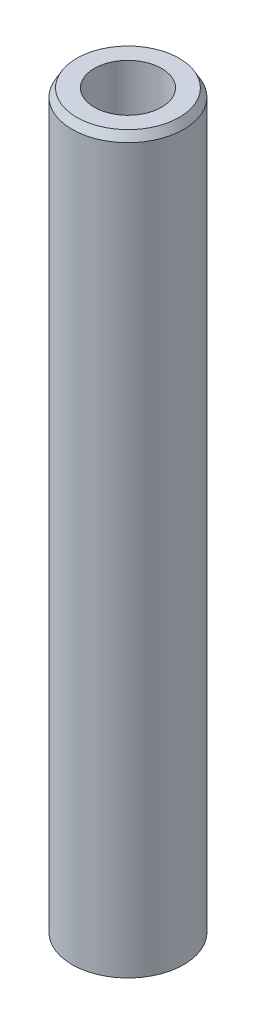
from build123d import *
from OCP.BRepFilletAPI import BRepFilletAPI_MakeChamfer

# Parameters (mm, degrees)
SKETCH1_R           = 30
BOSS_EXTRUDE1_DEPTH = 395.231846825
SKETCH2_R           = 18.0727539
CUT_EXTRUDE1_DEPTH  = 398.502468854
CHAMFER1_SIZE       = 4.315093977
CHAMFER1_SIZE2      = 2.491320669


with BuildPart() as part:
    # Sketch1 → Boss-Extrude1 (new body)
    with BuildSketch(Plane(origin=(0, 0, 0), x_dir=(1, 0, 0), z_dir=(0, 1, 0))):
        Circle(SKETCH1_R)
    extrude(amount=BOSS_EXTRUDE1_DEPTH)

    # Sketch2 → Cut-Extrude1 (cut, through all)
    with BuildSketch(Plane(origin=(0, 0, 0), x_dir=(1, 0, 0), z_dir=(0, 1, 0))):
        Circle(SKETCH2_R)
    extrude(amount=CUT_EXTRUDE1_DEPTH, mode=Mode.SUBTRACT)

    # Chamfer1: one chamfer whose edges measure the first distance from different faces: ONE call of the kernel's chamfer builder (chamfer() names one face for all edges)
    chamfer1_edges_1 = [part.edges().sort_by_distance(p)[0] for p in [
        (-30, 395.231846825, 0),
    ]]
    chamfer1_side_1 = [part.faces().sort_by_distance(p)[0] for p in [
        (-30, 197.615923413, 0),
    ]]
    chamfer1_edges_2 = [part.edges().sort_by_distance(p)[0] for p in [
        (-30, 0, 0),
    ]]
    chamfer1_side_2 = [part.faces().sort_by_distance(p)[0] for p in [
        (-29.151471863, 0, 0),
    ]]
    chamfer1 = BRepFilletAPI_MakeChamfer(part.part.solid().wrapped)
    for e in chamfer1_edges_1:
        chamfer1.Add(CHAMFER1_SIZE, CHAMFER1_SIZE2, e.wrapped, chamfer1_side_1[0].wrapped)  # the first distance lies on this face
    for e in chamfer1_edges_2:
        chamfer1.Add(CHAMFER1_SIZE, CHAMFER1_SIZE2, e.wrapped, chamfer1_side_2[0].wrapped)  # the first distance lies on this face
    add(Compound.cast(chamfer1.Shape()), mode=Mode.REPLACE)


solid = part.part
